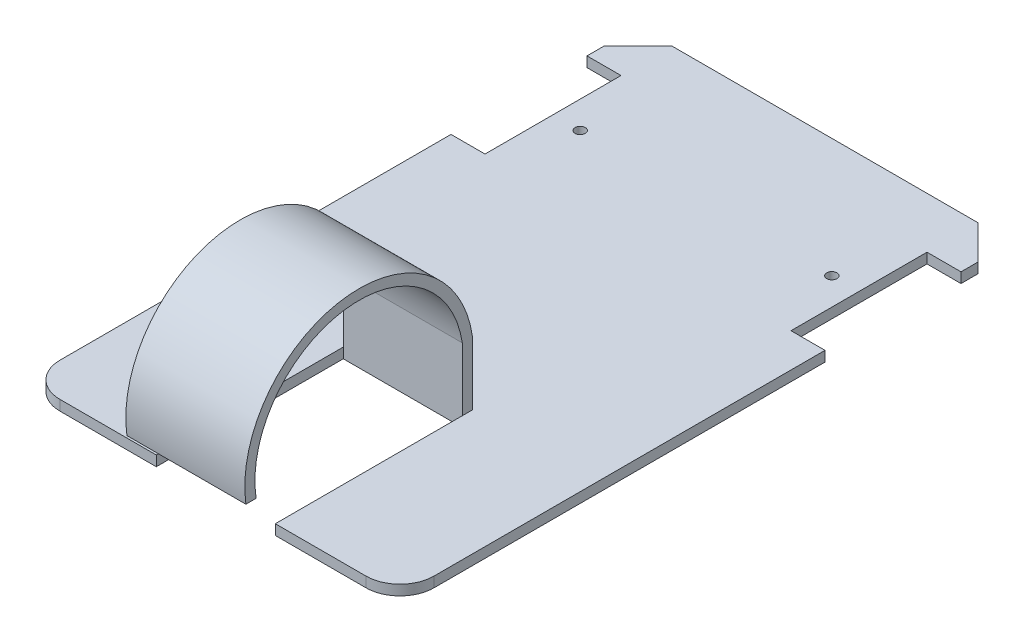
from build123d import *

# Parameters (mm, degrees)
SKETCH3_W           = 110
SKETCH3_H           = 180
BOSS_EXTRUDE1_DEPTH = 3
CUT_EXTRUDE1_REACH  = 107.518
SKETCH4_W           = 35
SKETCH4_H           = 55
CUT_EXTRUDE2_REACH  = 107.518
SKETCH5_R           = 1.5
FILLET1_R           = 10
FILLET2_R           = 10
SKETCH9_W           = 35
SKETCH9_H           = 3
BOSS_EXTRUDE2_DEPTH = 18.556788
BOSS_EXTRUDE3_START = -16.676438017
BOSS_EXTRUDE3_DEPTH = 35
CUT_EXTRUDE3_REACH  = 124.809
SKETCH16_W          = 10
SKETCH16_H          = 40
CHAMFER1_SIZE       = 10


# Read off the part's stored shape, not the designer's step: Boss-Extrude3
with BuildPart() as part:
    # Sketch3 → Boss-Extrude1 (new body)
    with BuildSketch(Plane(origin=(0, 0, 0), x_dir=(1, 0, 0), z_dir=(0, 1, 0))):
        Rectangle(SKETCH3_W, SKETCH3_H)
    extrude(amount=BOSS_EXTRUDE1_DEPTH)

    # Sketch4 → Cut-Extrude1 (cut, up to next)
    with BuildSketch(Plane(origin=(0, 3, 0), x_dir=(1, 0, 0), z_dir=(0, 1, 0)), mode=Mode.PRIVATE) as cut_extrude1_sk1:
        with Locations((0.823561983, -62.5)):
            Rectangle(SKETCH4_W, SKETCH4_H)
    cut_extrude1_tool1 = extrude(cut_extrude1_sk1.sketch, amount=-CUT_EXTRUDE1_REACH, mode=Mode.PRIVATE) & part.part
    add(cut_extrude1_tool1.solids().sort_by_distance((0.823562, 3, 62.5))[0], mode=Mode.SUBTRACT)

    # Sketch5 → Cut-Extrude2 (cut, up to next)
    with BuildSketch(Plane(origin=(0, 3, 0), x_dir=(1, 0, 0), z_dir=(0, 1, 0)), mode=Mode.PRIVATE) as cut_extrude2_sk1:
        with Locations(Location((37, 55, 0), (0, 0, 270))):
            Circle(SKETCH5_R)
    cut_extrude2_tool1 = extrude(cut_extrude2_sk1.sketch, amount=-CUT_EXTRUDE2_REACH, mode=Mode.PRIVATE) & part.part
    # Sketch5 → Cut-Extrude2 (cut, up to next)
    with BuildSketch(Plane(origin=(0, 3, 0), x_dir=(1, 0, 0), z_dir=(0, 1, 0)), mode=Mode.PRIVATE) as cut_extrude2_sk2:
        with Locations(Location((-37, 55, 0), (0, 0, 270))):
            Circle(SKETCH5_R)
    cut_extrude2_tool2 = extrude(cut_extrude2_sk2.sketch, amount=-CUT_EXTRUDE2_REACH, mode=Mode.PRIVATE) & part.part
    add(cut_extrude2_tool1.solids().sort_by_distance((37, 3, -55))[0], mode=Mode.SUBTRACT)
    add(cut_extrude2_tool2.solids().sort_by_distance((-37, 3, -55))[0], mode=Mode.SUBTRACT)

    # Fillet1
    fillet1_edges = [part.edges().sort_by_distance(p)[0] for p in [
        (-55, 1.5, 90),
    ]]
    fillet(fillet1_edges, radius=FILLET1_R)

    # Fillet2
    fillet2_edges = [part.edges().sort_by_distance(p)[0] for p in [
        (55, 1.5, 90),
    ]]
    fillet(fillet2_edges, radius=FILLET2_R)

    # Sketch9 → Boss-Extrude2 (add)
    with BuildSketch(Plane(origin=(0, 3, 0), x_dir=(1, 0, 0), z_dir=(0, 1, 0))):
        with Locations((0.823561983, -33.5)):
            Rectangle(SKETCH9_W, SKETCH9_H)
    extrude(amount=BOSS_EXTRUDE2_DEPTH)

    # Boss-Extrude3 outline → Boss-Extrude3 (add)
    with BuildSketch(Plane.YZ.offset(BOSS_EXTRUDE3_START)):
        with BuildLine():
            ThreePointArc((21.556787547, 32), (50.241297741, 69.962903968), (12.278393773, 98.647414162))
            Line((12.278393773, 98.647414162), (12.278393773, 95.647414162))
            ThreePointArc((12.278393773, 95.647414162), (47.241297741, 69.962903968), (21.556787547, 35))
            Line((21.556787547, 35), (21.556787547, 32))
        make_face()
    extrude(amount=BOSS_EXTRUDE3_DEPTH)

    # Sketch16 → Cut-Extrude3 (cut, up to next)
    with BuildSketch(Plane(origin=(0, 3, 0), x_dir=(1, 0, 0), z_dir=(0, 1, 0)), mode=Mode.PRIVATE) as cut_extrude3_sk1:
        with Locations((50, 55)):
            Rectangle(SKETCH16_W, SKETCH16_H)
    cut_extrude3_tool1 = extrude(cut_extrude3_sk1.sketch, amount=-CUT_EXTRUDE3_REACH, mode=Mode.PRIVATE) & part.part
    # Sketch16 → Cut-Extrude3 (cut, up to next)
    with BuildSketch(Plane(origin=(0, 3, 0), x_dir=(1, 0, 0), z_dir=(0, 1, 0)), mode=Mode.PRIVATE) as cut_extrude3_sk2:
        with Locations((-50, 55)):
            Rectangle(SKETCH16_W, SKETCH16_H)
    cut_extrude3_tool2 = extrude(cut_extrude3_sk2.sketch, amount=-CUT_EXTRUDE3_REACH, mode=Mode.PRIVATE) & part.part
    add(cut_extrude3_tool1.solids().sort_by_distance((50, 3, -55))[0], mode=Mode.SUBTRACT)
    add(cut_extrude3_tool2.solids().sort_by_distance((-50, 3, -55))[0], mode=Mode.SUBTRACT)

    # Chamfer1
    chamfer1_edges = [part.edges().sort_by_distance(p)[0] for p in [
        (-55, 1.5, -90),
        (55, 1.5, -90),
    ]]
    chamfer(chamfer1_edges, length=CHAMFER1_SIZE)


solid = part.part
